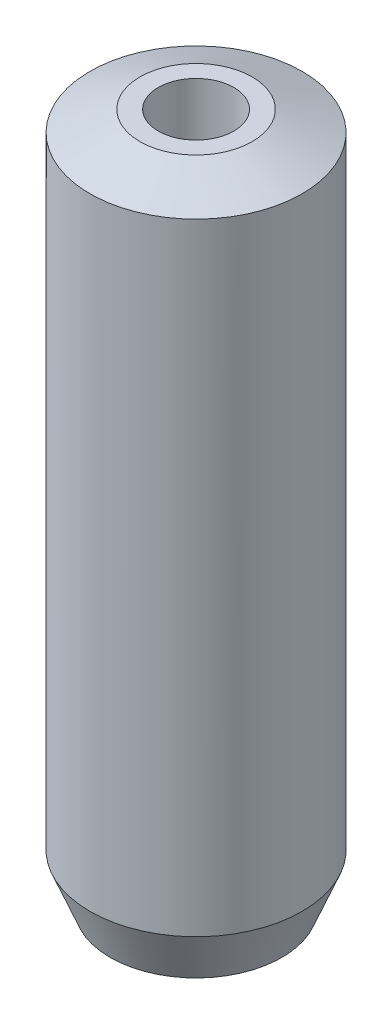
from build123d import *
from OCP.BRepFilletAPI import BRepFilletAPI_MakeChamfer

# Parameters (mm, degrees)
SKETCH1_R           = 30
BOSS_EXTRUDE1_DEPTH = 195.601865288
SKETCH2_R           = 10.692388037
CUT_EXTRUDE1_DEPTH  = 201.150167884
CHAMFER1_SIZE       = 5.702422486
CHAMFER1_SIZE2      = 14.137503564


with BuildPart() as part:
    # Sketch1 → Boss-Extrude1 (new body)
    with BuildSketch(Plane(origin=(0, 0, 0), x_dir=(1, 0, 0), z_dir=(0, 1, 0))):
        Circle(SKETCH1_R)
    extrude(amount=BOSS_EXTRUDE1_DEPTH)

    # Sketch2 → Cut-Extrude1 (cut, through all)
    with BuildSketch(Plane(origin=(0, 0, 0), x_dir=(1, 0, 0), z_dir=(0, 1, 0))):
        Circle(SKETCH2_R)
    extrude(amount=CUT_EXTRUDE1_DEPTH, mode=Mode.SUBTRACT)

    # Chamfer1: one chamfer whose edges measure the first distance from different faces: ONE call of the kernel's chamfer builder (chamfer() names one face for all edges)
    chamfer1_edges_1 = [part.edges().sort_by_distance(p)[0] for p in [
        (-30, 195.601865288, 0),
    ]]
    chamfer1_side_1 = [part.faces().sort_by_distance(p)[0] for p in [
        (-30, 97.800932644, 0),
    ]]
    chamfer1_edges_2 = [part.edges().sort_by_distance(p)[0] for p in [
        (-30, 0, 0),
    ]]
    chamfer1_side_2 = [part.faces().sort_by_distance(p)[0] for p in [
        (-29.151471863, 0, 0),
    ]]
    chamfer1 = BRepFilletAPI_MakeChamfer(part.part.solid().wrapped)
    for e in chamfer1_edges_1:
        chamfer1.Add(CHAMFER1_SIZE, CHAMFER1_SIZE2, e.wrapped, chamfer1_side_1[0].wrapped)  # the first distance lies on this face
    for e in chamfer1_edges_2:
        chamfer1.Add(CHAMFER1_SIZE, CHAMFER1_SIZE2, e.wrapped, chamfer1_side_2[0].wrapped)  # the first distance lies on this face
    add(Compound.cast(chamfer1.Shape()), mode=Mode.REPLACE)


solid = part.part
